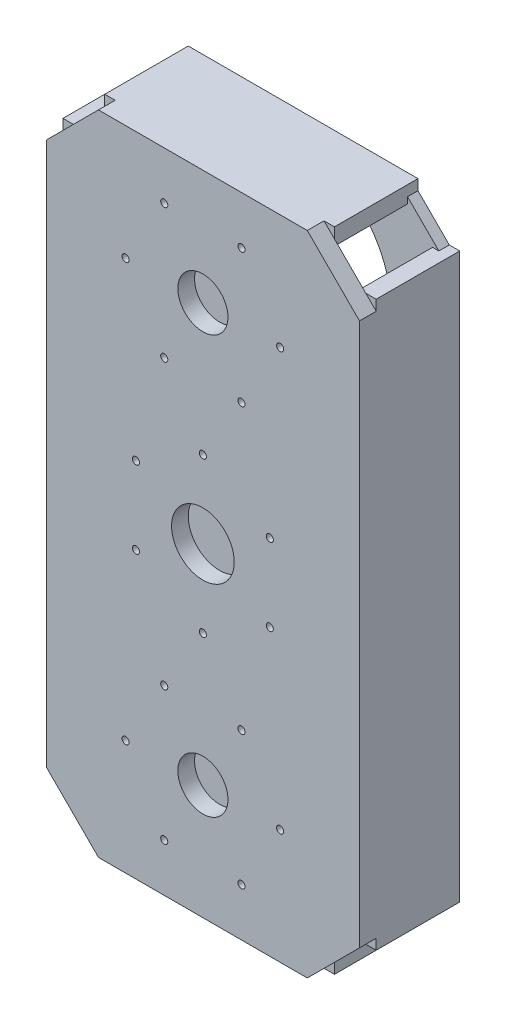
from build123d import *

# Parameters (mm, degrees)
SK_TOP_PLATE_R      = 1.7
SK_TOP_PLATE_R_2    = 12
SK_TOP_PLATE_R_3    = 15
TOP_PLATE_DEPTH     = 8
SK_FRONT_WALL_W     = 40
SK_FRONT_WALL_H     = 270
FRONT_WALL_DEPTH    = 8
SK_BACK_WALL_W      = 40
SK_BACK_WALL_H      = 270
BACK_WALL_DEPTH     = 8
SK_LEFT_WALL_W      = 110
SK_LEFT_WALL_H      = 40
LEFT_WALL_DEPTH     = 8
SK_RIGHT_WALL_W     = 110
SK_RIGHT_WALL_H     = 40
RIGHT_WALL_DEPTH    = 8
SK_BOTTOM_PLATE_R   = 47
SK_BOTTOM_PLATE_R_2 = 20
BOTTOM_PLATE_DEPTH  = 5


with BuildPart() as part:
    # SK_Top_Plate → Top_Plate (new body)
    with BuildSketch(Plane.XY.offset(131)):
        Polygon((-50, -155), (50, -155), (75, -130), (75, 130), (50, 155), (-50, 155), (-75, 130), (-75, -130), align=None)
        with Locations((37, 100)):
            Circle(SK_TOP_PLATE_R, mode=Mode.SUBTRACT)
        with Locations((18.5, 132.04293994)):
            Circle(SK_TOP_PLATE_R, mode=Mode.SUBTRACT)
        with Locations((-18.5, 132.04293994)):
            Circle(SK_TOP_PLATE_R, mode=Mode.SUBTRACT)
        with Locations((-37, 100)):
            Circle(SK_TOP_PLATE_R, mode=Mode.SUBTRACT)
        with Locations((-18.5, 67.95706006)):
            Circle(SK_TOP_PLATE_R, mode=Mode.SUBTRACT)
        with Locations((18.5, 67.95706006)):
            Circle(SK_TOP_PLATE_R, mode=Mode.SUBTRACT)
        with Locations((0, 100)):
            Circle(SK_TOP_PLATE_R_2, mode=Mode.SUBTRACT)
        with Locations((37, -100)):
            Circle(SK_TOP_PLATE_R, mode=Mode.SUBTRACT)
        with Locations((18.5, -67.95706006)):
            Circle(SK_TOP_PLATE_R, mode=Mode.SUBTRACT)
        with Locations((-18.5, -67.95706006)):
            Circle(SK_TOP_PLATE_R, mode=Mode.SUBTRACT)
        with Locations((-37, -100)):
            Circle(SK_TOP_PLATE_R, mode=Mode.SUBTRACT)
        with Locations((-18.5, -132.04293994)):
            Circle(SK_TOP_PLATE_R, mode=Mode.SUBTRACT)
        with Locations((18.5, -132.04293994)):
            Circle(SK_TOP_PLATE_R, mode=Mode.SUBTRACT)
        with Locations((0, -100)):
            Circle(SK_TOP_PLATE_R_2, mode=Mode.SUBTRACT)
        with Locations((32.04293994, 18.5)):
            Circle(SK_TOP_PLATE_R, mode=Mode.SUBTRACT)
        with Locations((0, 37)):
            Circle(SK_TOP_PLATE_R, mode=Mode.SUBTRACT)
        with Locations((-32.04293994, 18.5)):
            Circle(SK_TOP_PLATE_R, mode=Mode.SUBTRACT)
        with Locations((-32.04293994, -18.5)):
            Circle(SK_TOP_PLATE_R, mode=Mode.SUBTRACT)
        with Locations((0, -37)):
            Circle(SK_TOP_PLATE_R, mode=Mode.SUBTRACT)
        with Locations((32.04293994, -18.5)):
            Circle(SK_TOP_PLATE_R, mode=Mode.SUBTRACT)
        Circle(SK_TOP_PLATE_R_3, mode=Mode.SUBTRACT)
    extrude(amount=TOP_PLATE_DEPTH)

    # SK_Front_Wall → Front_Wall (add)
    with BuildSketch(Plane(origin=(67, 0, 0), x_dir=(0, 0, -1), z_dir=(1, 0, 0))):
        with Locations((-111, 0)):
            Rectangle(SK_FRONT_WALL_W, SK_FRONT_WALL_H)
    extrude(amount=FRONT_WALL_DEPTH)

    # SK_Back_Wall → Back_Wall (add)
    with BuildSketch(Plane(origin=(-75, 0, 0), x_dir=(0, 0, -1), z_dir=(1, 0, 0))):
        with Locations((-111, 0)):
            Rectangle(SK_BACK_WALL_W, SK_BACK_WALL_H)
    extrude(amount=BACK_WALL_DEPTH)

    # SK_Left_Wall → Left_Wall (add)
    with BuildSketch(Plane(origin=(0, 147, 0), x_dir=(1, 0, 0), z_dir=(0, 1, 0))):
        with Locations((0, -111)):
            Rectangle(SK_LEFT_WALL_W, SK_LEFT_WALL_H)
    extrude(amount=LEFT_WALL_DEPTH)

    # SK_Right_Wall → Right_Wall (add)
    with BuildSketch(Plane(origin=(0, -155, 0), x_dir=(1, 0, 0), z_dir=(0, 1, 0))):
        with Locations((0, -111)):
            Rectangle(SK_RIGHT_WALL_W, SK_RIGHT_WALL_H)
    extrude(amount=RIGHT_WALL_DEPTH)

    # SK_Bottom_Plate → Bottom_Plate (add)
    with BuildSketch(Plane.XY.offset(91)):
        Polygon((-50, -155), (50, -155), (75, -130), (75, 130), (50, 155), (-50, 155), (-75, 130), (-75, -130), align=None)
        with Locations((0, 100)):
            Circle(SK_BOTTOM_PLATE_R, mode=Mode.SUBTRACT)
        with Locations((0, -100)):
            Circle(SK_BOTTOM_PLATE_R, mode=Mode.SUBTRACT)
        Circle(SK_BOTTOM_PLATE_R_2, mode=Mode.SUBTRACT)
    extrude(amount=BOTTOM_PLATE_DEPTH)


solid = part.part
